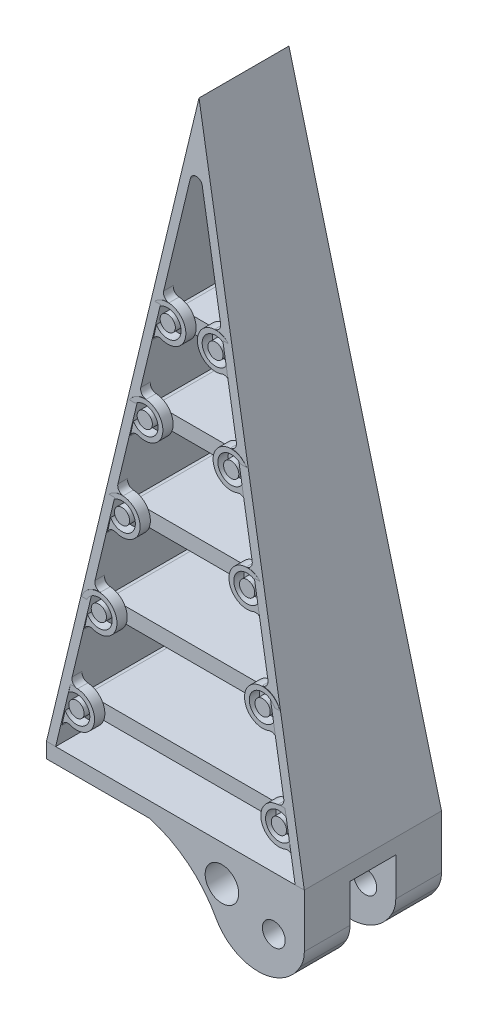
from build123d import *
from build123d.topology import SkipClean

# Parameters (mm, degrees)
AUFSATZ_LINEAR_AUSTRAGEN4_DEPTH      = 18
SCHNITT_LINEAR_AUSTRAGEN1_DEPTH      = 89.73537072
AUFSATZ_LINEAR_AUSTRAGEN5_DEPTH      = 5.37
AUFSATZ_LINEAR_AUSTRAGEN5_DEPTH_BACK = 5.37
AUFSATZ_LINEAR_AUSTRAGEN6_DEPTH      = 5.85
AUFSATZ_LINEAR_AUSTRAGEN6_DEPTH_BACK = 5.85
AUFSATZ_LINEAR_AUSTRAGEN7_DEPTH      = 6.3
AUFSATZ_LINEAR_AUSTRAGEN7_DEPTH_BACK = 6.3
AUFSATZ_LINEAR_AUSTRAGEN8_DEPTH      = 6.8
AUFSATZ_LINEAR_AUSTRAGEN8_DEPTH_BACK = 6.8
AUFSATZ_LINEAR_AUSTRAGEN9_DEPTH      = 7.2
AUFSATZ_LINEAR_AUSTRAGEN9_DEPTH_BACK = 7.2
SKIZZE13_R                           = 1
AUFSATZ_LINEAR_AUSTRAGEN12_DEPTH     = 1.5
SKIZZE15_R                           = 1
AUFSATZ_LINEAR_AUSTRAGEN14_DEPTH     = 1.5
SKIZZE14_R                           = 1
AUFSATZ_LINEAR_AUSTRAGEN13_DEPTH     = 1.5
SKIZZE16_R                           = 1
AUFSATZ_LINEAR_AUSTRAGEN15_DEPTH     = 1.5
SKIZZE17_R                           = 1
AUFSATZ_LINEAR_AUSTRAGEN16_DEPTH     = 1.5
SKIZZE18_R                           = 1
AUFSATZ_LINEAR_AUSTRAGEN17_DEPTH     = 1.5
SKIZZE19_R                           = 1
AUFSATZ_LINEAR_AUSTRAGEN18_DEPTH     = 1.5
SKIZZE20_R                           = 1
AUFSATZ_LINEAR_AUSTRAGEN19_DEPTH     = 1.5
SKIZZE21_R                           = 1
AUFSATZ_LINEAR_AUSTRAGEN20_DEPTH     = 1.5
SKIZZE22_R                           = 1
AUFSATZ_LINEAR_AUSTRAGEN21_DEPTH     = 1.5
SKIZZE24_R                           = 2.375
SKIZZE24_R_2                         = 1.75
AUFSATZ_LINEAR_AUSTRAGEN22_DEPTH     = 1.35
SKIZZE25_R                           = 2.375
SKIZZE25_R_2                         = 1.75
AUFSATZ_LINEAR_AUSTRAGEN23_DEPTH     = 1.35
SKIZZE26_R                           = 2.375
SKIZZE26_R_2                         = 1.75
AUFSATZ_LINEAR_AUSTRAGEN24_DEPTH     = 1.35
SKIZZE27_R                           = 2.375
SKIZZE27_R_2                         = 1.75
AUFSATZ_LINEAR_AUSTRAGEN25_DEPTH     = 1.35
SKIZZE28_R                           = 2.375
SKIZZE28_R_2                         = 1.75
AUFSATZ_LINEAR_AUSTRAGEN26_DEPTH     = 1.35
AUFSATZ_LINEAR_START                 = -1.35
SKIZZE29_R                           = 2.375
SKIZZE29_R_2                         = 1.75
AUFSATZ_LINEAR_AUSTRAGEN27_DEPTH     = 1.35
SKIZZE30_R                           = 2.375
SKIZZE30_R_2                         = 1.75
AUFSATZ_LINEAR_AUSTRAGEN28_DEPTH     = 1.35
SKIZZE31_R                           = 2.375
SKIZZE31_R_2                         = 1.75
AUFSATZ_LINEAR_AUSTRAGEN29_DEPTH     = 1.35
SKIZZE32_R                           = 2.375
SKIZZE32_R_2                         = 1.75
AUFSATZ_LINEAR_AUSTRAGEN30_DEPTH     = 1.35
SKIZZE33_R                           = 2.375
SKIZZE33_R_2                         = 1.75
AUFSATZ_LINEAR_AUSTRAGEN31_DEPTH     = 1.35
VERRUNDUNG1_R                        = 0.8
VERRUNDUNG2_R                        = 0.8
AUFSATZ_LINEAR_AUSTRAGEN32_DEPTH     = 2
SKIZZE38_R                           = 4
SKIZZE38_R_2                         = 1.5
AUFSATZ_LINEAR_AUSTRAGEN34_DEPTH     = 18
SCHNITT_LINEAR_START                 = -6
SKIZZE39_R                           = 4
SCHNITT_LINEAR_AUSTRAGEN2_DEPTH      = 6
SKIZZE40_W                           = 6
SKIZZE40_H                           = 11.711498973
SCHNITT_LINEAR_AUSTRAGEN3_DEPTH      = 43.6
SKIZZE41_R                           = 2.2
SCHNITT_LINEAR_AUSTRAGEN4_DEPTH      = 96.518560321
AUFSATZ_LINEAR_AUSTRAGEN35_DEPTH     = 25


with BuildPart() as part:
    # Skizze1 → Aufsatz-Linear austragen4 (new body)
    with BuildSketch(Plane.XY):
        Polygon((0, 0), (16.911148858, -80), (15.711148858, -80), (0, -5.676728459), (-15.711148858, -80), (-16.911148858, -80), align=None)
    extrude(amount=AUFSATZ_LINEAR_AUSTRAGEN4_DEPTH)

    # Skizze11 → Schnitt-Linear austragen1 (cut, through all)
    with BuildSketch(Plane(origin=(17, 0, 0), x_dir=(0, 0, -1), z_dir=(1, 0, 0))):
        Polygon((-18, -80), (-14.9, 0), (-18, 0), align=None)
        Polygon((0, -80), (-3.1, 0), (0, 0), align=None)
    extrude(amount=-SCHNITT_LINEAR_AUSTRAGEN1_DEPTH, mode=Mode.SUBTRACT)

    # Skizze24 → Aufsatz-Linear austragen22 (add)
    # profile 1 of 2: a face of its own
    with BuildSketch(Plane.XY.offset(15.87)):
        with Locations((-3.132547008, -26.676728459)):
            Circle(SKIZZE24_R)
        with Locations((-3.132547008, -26.676728459)):
            Circle(SKIZZE24_R_2, mode=Mode.SUBTRACT)
    # profile 2 of 2: a face of its own
    with BuildSketch(Plane.XY.offset(15.87)):
        with Locations((3.132547008, -26.676728459)):
            Circle(SKIZZE24_R)
        with Locations((3.132547008, -26.676728459)):
            Circle(SKIZZE24_R_2, mode=Mode.SUBTRACT)
    extrude(amount=-AUFSATZ_LINEAR_AUSTRAGEN22_DEPTH)

    # Skizze25 → Aufsatz-Linear austragen23 (add)
    # profile 1 of 2: a face of its own
    with BuildSketch(Plane.XY.offset(16.35)):
        with Locations((-5.669219336, -38.676728459)):
            Circle(SKIZZE25_R)
        with Locations((-5.669219336, -38.676728459)):
            Circle(SKIZZE25_R_2, mode=Mode.SUBTRACT)
    # profile 2 of 2: a face of its own
    with BuildSketch(Plane.XY.offset(16.35)):
        with Locations((5.669219336, -38.676728459)):
            Circle(SKIZZE25_R)
        with Locations((5.669219336, -38.676728459)):
            Circle(SKIZZE25_R_2, mode=Mode.SUBTRACT)
    extrude(amount=-AUFSATZ_LINEAR_AUSTRAGEN23_DEPTH)

    # Skizze26 → Aufsatz-Linear austragen24 (add)
    # profile 1 of 2: a face of its own
    with BuildSketch(Plane.XY.offset(16.8)):
        with Locations((-8.205891665, -50.676728459)):
            Circle(SKIZZE26_R)
        with Locations((-8.205891665, -50.676728459)):
            Circle(SKIZZE26_R_2, mode=Mode.SUBTRACT)
    # profile 2 of 2: a face of its own
    with BuildSketch(Plane.XY.offset(16.8)):
        with Locations((8.205891665, -50.676728459)):
            Circle(SKIZZE26_R)
        with Locations((8.205891665, -50.676728459)):
            Circle(SKIZZE26_R_2, mode=Mode.SUBTRACT)
    extrude(amount=-AUFSATZ_LINEAR_AUSTRAGEN24_DEPTH)

    # Skizze27 → Aufsatz-Linear austragen25 (add)
    # profile 1 of 2: a face of its own
    with BuildSketch(Plane.XY.offset(17.3)):
        with Locations((-10.742563994, -62.676728459)):
            Circle(SKIZZE27_R)
        with Locations((-10.742563994, -62.676728459)):
            Circle(SKIZZE27_R_2, mode=Mode.SUBTRACT)
    # profile 2 of 2: a face of its own
    with BuildSketch(Plane.XY.offset(17.3)):
        with Locations((10.742563994, -62.676728459)):
            Circle(SKIZZE27_R)
        with Locations((10.742563994, -62.676728459)):
            Circle(SKIZZE27_R_2, mode=Mode.SUBTRACT)
    extrude(amount=-AUFSATZ_LINEAR_AUSTRAGEN25_DEPTH)

    # Skizze28 → Aufsatz-Linear austragen26 (add)
    # profile 1 of 2: a face of its own
    with BuildSketch(Plane.XY.offset(17.7)):
        with Locations((-13.279236322, -74.676728459)):
            Circle(SKIZZE28_R)
        with Locations((-13.279236322, -74.676728459)):
            Circle(SKIZZE28_R_2, mode=Mode.SUBTRACT)
    # profile 2 of 2: a face of its own
    with BuildSketch(Plane.XY.offset(17.7)):
        with Locations((13.279236322, -74.676728459)):
            Circle(SKIZZE28_R)
        with Locations((13.279236322, -74.676728459)):
            Circle(SKIZZE28_R_2, mode=Mode.SUBTRACT)
    extrude(amount=-AUFSATZ_LINEAR_AUSTRAGEN26_DEPTH)

    # Skizze29 → Aufsatz-Linear austragen27 (add)
    # profile 1 of 2: a face of its own
    with BuildSketch(Plane(origin=(0, 0, 2.13), x_dir=(-1, 0, 0), z_dir=(0, 0, -1)).offset(AUFSATZ_LINEAR_START)):
        with Locations((-3.132547008, -26.676728459)):
            Circle(SKIZZE29_R)
        with Locations((-3.132547008, -26.676728459)):
            Circle(SKIZZE29_R_2, mode=Mode.SUBTRACT)
    # profile 2 of 2: a face of its own
    with BuildSketch(Plane(origin=(0, 0, 2.13), x_dir=(-1, 0, 0), z_dir=(0, 0, -1)).offset(AUFSATZ_LINEAR_START)):
        with Locations((3.132547008, -26.676728459)):
            Circle(SKIZZE29_R)
        with Locations((3.132547008, -26.676728459)):
            Circle(SKIZZE29_R_2, mode=Mode.SUBTRACT)
    extrude(amount=AUFSATZ_LINEAR_AUSTRAGEN27_DEPTH)

    # Skizze30 → Aufsatz-Linear austragen28 (add)
    # profile 1 of 2: a face of its own
    with BuildSketch(Plane(origin=(0, 0, 1.65), x_dir=(-1, 0, 0), z_dir=(0, 0, -1)).offset(AUFSATZ_LINEAR_START)):
        with Locations((-5.669219336, -38.676728459)):
            Circle(SKIZZE30_R)
        with Locations((-5.669219336, -38.676728459)):
            Circle(SKIZZE30_R_2, mode=Mode.SUBTRACT)
    # profile 2 of 2: a face of its own
    with BuildSketch(Plane(origin=(0, 0, 1.65), x_dir=(-1, 0, 0), z_dir=(0, 0, -1)).offset(AUFSATZ_LINEAR_START)):
        with Locations((5.669219336, -38.676728459)):
            Circle(SKIZZE30_R)
        with Locations((5.669219336, -38.676728459)):
            Circle(SKIZZE30_R_2, mode=Mode.SUBTRACT)
    extrude(amount=AUFSATZ_LINEAR_AUSTRAGEN28_DEPTH)

    # Skizze31 → Aufsatz-Linear austragen29 (add)
    # profile 1 of 2: a face of its own
    with BuildSketch(Plane(origin=(0, 0, 1.2), x_dir=(-1, 0, 0), z_dir=(0, 0, -1)).offset(AUFSATZ_LINEAR_START)):
        with Locations((-8.205891665, -50.676728459)):
            Circle(SKIZZE31_R)
        with Locations((-8.205891665, -50.676728459)):
            Circle(SKIZZE31_R_2, mode=Mode.SUBTRACT)
    # profile 2 of 2: a face of its own
    with BuildSketch(Plane(origin=(0, 0, 1.2), x_dir=(-1, 0, 0), z_dir=(0, 0, -1)).offset(AUFSATZ_LINEAR_START)):
        with Locations((8.205891665, -50.676728459)):
            Circle(SKIZZE31_R)
        with Locations((8.205891665, -50.676728459)):
            Circle(SKIZZE31_R_2, mode=Mode.SUBTRACT)
    extrude(amount=AUFSATZ_LINEAR_AUSTRAGEN29_DEPTH)

    # Skizze32 → Aufsatz-Linear austragen30 (add)
    # profile 1 of 2: a face of its own
    with BuildSketch(Plane(origin=(0, 0, 0.7), x_dir=(-1, 0, 0), z_dir=(0, 0, -1)).offset(AUFSATZ_LINEAR_START)):
        with Locations((-10.742563994, -62.676728459)):
            Circle(SKIZZE32_R)
        with Locations((-10.742563994, -62.676728459)):
            Circle(SKIZZE32_R_2, mode=Mode.SUBTRACT)
    # profile 2 of 2: a face of its own
    with BuildSketch(Plane(origin=(0, 0, 0.7), x_dir=(-1, 0, 0), z_dir=(0, 0, -1)).offset(AUFSATZ_LINEAR_START)):
        with Locations((10.742563994, -62.676728459)):
            Circle(SKIZZE32_R)
        with Locations((10.742563994, -62.676728459)):
            Circle(SKIZZE32_R_2, mode=Mode.SUBTRACT)
    extrude(amount=AUFSATZ_LINEAR_AUSTRAGEN30_DEPTH)

    # Skizze33 → Aufsatz-Linear austragen31 (add)
    # profile 1 of 2: a face of its own
    with BuildSketch(Plane(origin=(0, 0, 0.3), x_dir=(-1, 0, 0), z_dir=(0, 0, -1)).offset(AUFSATZ_LINEAR_START)):
        with Locations((-13.279236322, -74.676728459)):
            Circle(SKIZZE33_R)
        with Locations((-13.279236322, -74.676728459)):
            Circle(SKIZZE33_R_2, mode=Mode.SUBTRACT)
    # profile 2 of 2: a face of its own
    with BuildSketch(Plane(origin=(0, 0, 0.3), x_dir=(-1, 0, 0), z_dir=(0, 0, -1)).offset(AUFSATZ_LINEAR_START)):
        with Locations((13.279236322, -74.676728459)):
            Circle(SKIZZE33_R)
        with Locations((13.279236322, -74.676728459)):
            Circle(SKIZZE33_R_2, mode=Mode.SUBTRACT)
    extrude(amount=AUFSATZ_LINEAR_AUSTRAGEN31_DEPTH)

    # Verrundung1
    verrundung1_edges = [part.edges().sort_by_distance(p)[0] for p in [
        (0, -5.676728459, 9),
    ]]
    fillet(verrundung1_edges, radius=VERRUNDUNG1_R)

    # Verrundung2
    # the kernel refuses this fillet: 0.8 mm, written as the material it adds along each edge
    with BuildSketch(Plane(origin=(7.333926251, -40.370651683, 15), x_dir=(0.20681895998091462, -0.9783792300495819, 0), z_dir=(0, 0, 1)), Plane(origin=(9.87059858, -52.370651683, 15.45), x_dir=(0.20681895998091263, -0.9783792300495825, 0), z_dir=(0, 0, 1)), Plane(origin=(12.407270908, -64.370651683, 15.95), x_dir=(0.20681895998091412, -0.9783792300495822, 0), z_dir=(0, 0, 1)), Plane(origin=(14.943943237, -76.370651683, 16.35), x_dir=(0.20681895998090907, -0.9783792300495833, 0), z_dir=(0, 0, 1)), Plane(origin=(4.797253922, -28.370651683, 2.13), x_dir=(0.20681895998091462, -0.9783792300495819, 0), z_dir=(0, 0, 1)), Plane(origin=(7.333926251, -40.370651683, 1.65), x_dir=(0.20681895998091462, -0.9783792300495819, 0), z_dir=(0, 0, 1)), Plane(origin=(9.87059858, -52.370651683, 1.2), x_dir=(0.20681895998091412, -0.9783792300495822, 0), z_dir=(0, 0, 1)), Plane(origin=(12.407270908, -64.370651683, 0.7), x_dir=(0.20681895998091412, -0.9783792300495822, 0), z_dir=(0, 0, 1)), Plane(origin=(14.943943237, -76.370651683, 0.3), x_dir=(0.20681895998091113, -0.9783792300495827, 0), z_dir=(0, 0, 1)), Plane(origin=(4.797253922, -28.370651683, 14.52), x_dir=(0.20681895998091462, -0.9783792300495819, 0), z_dir=(0, 0, 1))) as verrundung2_piece_1:
        with BuildLine():
            CenterArc((1.137162009, -0.8), VERRUNDUNG2_R, 90, 98.665792169)
            ThreePointArc((0.346294794, -0.920536499), (0.221320117, -0.44214625), (0, 0))
            Line((0, 0), (1.137162009, 0))
        make_face()
    extrude(amount=1.35)
    with BuildSketch(Plane(origin=(6.505991795, -36.45401911, 15), x_dir=(-0.20681895998091487, 0.9783792300495819, 0), z_dir=(0, 0, 1))) as verrundung2_piece_2_section:
        with BuildLine():
            CenterArc((1.137162009, 0.8), VERRUNDUNG2_R, 171.334207831, 98.665792169)
            ThreePointArc((0.346294794, 0.920536499), (0.221320117, 0.44214625), (0, 0))
            Line((0, 0), (1.137162009, 0))
        make_face()
    verrundung2_piece_2 = extrude(amount=4.155498263, mode=Mode.PRIVATE)
    verrundung2_piece_2 = split(verrundung2_piece_2, bisect_by=Plane(origin=(6.217215771, -36.095589606, 16.298704097), z_dir=(0, -0.03872093994908253, -0.9992500632021294)), keep=Keep.TOP, mode=Mode.PRIVATE)
    add(verrundung2_piece_2)
    with BuildSketch(Plane(origin=(-9.87059858, -52.370651683, 15.45), x_dir=(-0.20681895998091412, -0.9783792300495822, 0), z_dir=(0, 0, 1)), Plane(origin=(-12.407270908, -64.370651683, 15.95), x_dir=(-0.2068189599809156, -0.9783792300495817, 0), z_dir=(0, 0, 1)), Plane(origin=(-14.943943237, -76.370651683, 16.35), x_dir=(-0.2068189599809131, -0.9783792300495824, 0), z_dir=(0, 0, 1)), Plane(origin=(-4.797253922, -28.370651683, 2.13), x_dir=(-0.20681895998091113, -0.9783792300495827, 0), z_dir=(0, 0, 1)), Plane(origin=(-7.333926251, -40.370651683, 1.65), x_dir=(-0.2068189599809139, -0.9783792300495822, 0), z_dir=(0, 0, 1)), Plane(origin=(-9.87059858, -52.370651683, 1.2), x_dir=(-0.20681895998091412, -0.9783792300495822, 0), z_dir=(0, 0, 1)), Plane(origin=(-12.407270908, -64.370651683, 0.7), x_dir=(-0.20681895998091412, -0.9783792300495822, 0), z_dir=(0, 0, 1)), Plane(origin=(-14.943943237, -76.370651683, 0.3), x_dir=(-0.2068189599809131, -0.9783792300495824, 0), z_dir=(0, 0, 1)), Plane(origin=(-4.797253922, -28.370651683, 14.52), x_dir=(-0.20681895998091177, -0.9783792300495826, 0), z_dir=(0, 0, 1)), Plane(origin=(-7.333926251, -40.370651683, 15), x_dir=(-0.20681895998091412, -0.9783792300495822, 0), z_dir=(0, 0, 1))) as verrundung2_piece_3:
        with BuildLine():
            CenterArc((1.137162009, 0.8), VERRUNDUNG2_R, 171.334207831, 98.665792169)
            ThreePointArc((0.346294794, 0.920536499), (0.221320117, 0.44214625), (0, 0))
            Line((0, 0), (1.137162009, 0))
        make_face()
    extrude(amount=1.35)
    with BuildSketch(Plane(origin=(-9.042664124, -48.45401911, 15.45), x_dir=(0.20681895998091288, 0.9783792300495825, 0), z_dir=(0, 0, 1))) as verrundung2_piece_4_section:
        with BuildLine():
            CenterArc((1.137162009, -0.8), VERRUNDUNG2_R, 90, 98.665792169)
            ThreePointArc((0.346294794, -0.920536499), (0.221320117, -0.44214625), (0, 0))
            Line((0, 0), (1.137162009, 0))
        make_face()
    verrundung2_piece_4 = extrude(amount=4.170498263, mode=Mode.PRIVATE)
    verrundung2_piece_4 = split(verrundung2_piece_4, bisect_by=Plane(origin=(-8.753891259, -48.095283689, 16.763692243), z_dir=(0, -0.03872093994908253, -0.9992500632021294)), keep=Keep.TOP, mode=Mode.PRIVATE)
    add(verrundung2_piece_4)
    with BuildSketch(Plane(origin=(9.042664124, -48.45401911, 15.45), x_dir=(-0.2068189599809156, 0.9783792300495817, 0), z_dir=(0, 0, 1))) as verrundung2_piece_5_section:
        with BuildLine():
            CenterArc((1.137162009, 0.8), VERRUNDUNG2_R, 171.334207831, 98.665792169)
            ThreePointArc((0.346294794, 0.920536499), (0.221320117, 0.44214625), (0, 0))
            Line((0, 0), (1.137162009, 0))
        make_face()
    verrundung2_piece_5 = extrude(amount=4.170498263, mode=Mode.PRIVATE)
    verrundung2_piece_5 = split(verrundung2_piece_5, bisect_by=Plane(origin=(8.753891259, -48.095283689, 16.763692243), z_dir=(0, -0.03872093994908253, -0.9992500632021294)), keep=Keep.TOP, mode=Mode.PRIVATE)
    add(verrundung2_piece_5)
    with BuildSketch(Plane(origin=(-11.579336453, -60.45401911, 15.95), x_dir=(0.2068189599809101, 0.9783792300495829, 0), z_dir=(0, 0, 1))) as verrundung2_piece_6_section:
        with BuildLine():
            CenterArc((1.137162009, -0.8), VERRUNDUNG2_R, 90, 98.665792169)
            ThreePointArc((0.346294794, -0.920536499), (0.221320117, -0.44214625), (0, 0))
            Line((0, 0), (1.137162009, 0))
        make_face()
    verrundung2_piece_6 = extrude(amount=4.135498263, mode=Mode.PRIVATE)
    verrundung2_piece_6 = split(verrundung2_piece_6, bisect_by=Plane(origin=(-11.290556099, -60.095998069, 17.228719925), z_dir=(0, -0.03872093994908253, -0.9992500632021294)), keep=Keep.TOP, mode=Mode.PRIVATE)
    add(verrundung2_piece_6)
    with BuildSketch(Plane(origin=(11.579336453, -60.45401911, 15.95), x_dir=(-0.20681895998091435, 0.978379230049582, 0), z_dir=(0, 0, 1))) as verrundung2_piece_7_section:
        with BuildLine():
            CenterArc((1.137162009, 0.8), VERRUNDUNG2_R, 171.334207831, 98.665792169)
            ThreePointArc((0.346294794, 0.920536499), (0.221320117, 0.44214625), (0, 0))
            Line((0, 0), (1.137162009, 0))
        make_face()
    verrundung2_piece_7 = extrude(amount=4.135498263, mode=Mode.PRIVATE)
    verrundung2_piece_7 = split(verrundung2_piece_7, bisect_by=Plane(origin=(11.290556099, -60.095998069, 17.228719925), z_dir=(0, -0.03872093994908253, -0.9992500632021294)), keep=Keep.TOP, mode=Mode.PRIVATE)
    add(verrundung2_piece_7)
    with BuildSketch(Plane(origin=(-14.116008781, -72.45401911, 16.35), x_dir=(0.20681895998091412, 0.9783792300495822, 0), z_dir=(0, 0, 1))) as verrundung2_piece_8_section:
        with BuildLine():
            CenterArc((1.137162009, -0.8), VERRUNDUNG2_R, 90, 98.665792169)
            ThreePointArc((0.346294794, -0.920536499), (0.221320117, -0.44214625), (0, 0))
            Line((0, 0), (1.137162009, 0))
        make_face()
    verrundung2_piece_8 = extrude(amount=1.35, mode=Mode.PRIVATE)
    verrundung2_piece_8 = split(verrundung2_piece_8, bisect_by=Plane(origin=(-13.827218085, -72.094512866, 17.693662374), z_dir=(0, -0.03872093994908253, -0.9992500632021294)), keep=Keep.TOP, mode=Mode.PRIVATE)
    add(verrundung2_piece_8)
    with BuildSketch(Plane(origin=(14.116008781, -72.45401911, 16.35), x_dir=(-0.20681895998091662, 0.9783792300495815, 0), z_dir=(0, 0, 1))) as verrundung2_piece_9_section:
        with BuildLine():
            CenterArc((1.137162009, 0.8), VERRUNDUNG2_R, 171.334207831, 98.665792169)
            ThreePointArc((0.346294794, 0.920536499), (0.221320117, 0.44214625), (0, 0))
            Line((0, 0), (1.137162009, 0))
        make_face()
    verrundung2_piece_9 = extrude(amount=1.35, mode=Mode.PRIVATE)
    verrundung2_piece_9 = split(verrundung2_piece_9, bisect_by=Plane(origin=(13.827218085, -72.094512866, 17.693662374), z_dir=(0, -0.03872093994908253, -0.9992500632021294)), keep=Keep.TOP, mode=Mode.PRIVATE)
    add(verrundung2_piece_9)
    with BuildSketch(Plane(origin=(3.969319467, -24.45401911, -0.690498263), x_dir=(-0.20681895998091412, 0.9783792300495822, 0), z_dir=(0, 0, 1))) as verrundung2_piece_10_section:
        with BuildLine():
            CenterArc((1.137162009, 0.8), VERRUNDUNG2_R, 171.334207831, 98.665792169)
            ThreePointArc((0.346294794, 0.920536499), (0.221320117, 0.44214625), (0, 0))
            Line((0, 0), (1.137162009, 0))
        make_face()
    verrundung2_piece_10 = extrude(amount=4.170498263, mode=Mode.PRIVATE)
    verrundung2_piece_10 = split(verrundung2_piece_10, bisect_by=Plane(origin=(3.680546602, -24.095283689, 2.166307757), z_dir=(0, -0.03872093994908251, 0.9992500632021294)), keep=Keep.TOP, mode=Mode.PRIVATE)
    add(verrundung2_piece_10)
    with BuildSketch(Plane(origin=(-3.969319467, -24.45401911, -0.690498263), x_dir=(0.20681895998091285, 0.9783792300495823, 0), z_dir=(0, 0, 1))) as verrundung2_piece_11_section:
        with BuildLine():
            CenterArc((1.137162009, -0.8), VERRUNDUNG2_R, 90, 98.665792169)
            ThreePointArc((0.346294794, -0.920536499), (0.221320117, -0.44214625), (0, 0))
            Line((0, 0), (1.137162009, 0))
        make_face()
    verrundung2_piece_11 = extrude(amount=4.170498263, mode=Mode.PRIVATE)
    verrundung2_piece_11 = split(verrundung2_piece_11, bisect_by=Plane(origin=(-3.680546602, -24.095283689, 2.166307757), z_dir=(0, -0.03872093994908251, 0.9992500632021294)), keep=Keep.TOP, mode=Mode.PRIVATE)
    add(verrundung2_piece_11)
    with BuildSketch(Plane(origin=(6.505991795, -36.45401911, -1.155498263), x_dir=(-0.20681895998091537, 0.9783792300495818, 0), z_dir=(0, 0, 1))) as verrundung2_piece_12_section:
        with BuildLine():
            CenterArc((1.137162009, 0.8), VERRUNDUNG2_R, 171.334207831, 98.665792169)
            ThreePointArc((0.346294794, 0.920536499), (0.221320117, 0.44214625), (0, 0))
            Line((0, 0), (1.137162009, 0))
        make_face()
    verrundung2_piece_12 = extrude(amount=4.155498263, mode=Mode.PRIVATE)
    verrundung2_piece_12 = split(verrundung2_piece_12, bisect_by=Plane(origin=(6.217215771, -36.095589606, 1.701295903), z_dir=(0, -0.03872093994908251, 0.9992500632021294)), keep=Keep.TOP, mode=Mode.PRIVATE)
    add(verrundung2_piece_12)
    with BuildSketch(Plane(origin=(-6.505991795, -36.45401911, -1.155498263), x_dir=(0.20681895998091288, 0.9783792300495825, 0), z_dir=(0, 0, 1))) as verrundung2_piece_13_section:
        with BuildLine():
            CenterArc((1.137162009, -0.8), VERRUNDUNG2_R, 90, 98.665792169)
            ThreePointArc((0.346294794, -0.920536499), (0.221320117, -0.44214625), (0, 0))
            Line((0, 0), (1.137162009, 0))
        make_face()
    verrundung2_piece_13 = extrude(amount=4.155498263, mode=Mode.PRIVATE)
    verrundung2_piece_13 = split(verrundung2_piece_13, bisect_by=Plane(origin=(-6.217215771, -36.095589606, 1.701295903), z_dir=(0, -0.03872093994908251, 0.9992500632021294)), keep=Keep.TOP, mode=Mode.PRIVATE)
    add(verrundung2_piece_13)
    with BuildSketch(Plane(origin=(9.042664124, -48.45401911, -1.620498263), x_dir=(-0.20681895998091412, 0.9783792300495822, 0), z_dir=(0, 0, 1))) as verrundung2_piece_14_section:
        with BuildLine():
            CenterArc((1.137162009, 0.8), VERRUNDUNG2_R, 171.334207831, 98.665792169)
            ThreePointArc((0.346294794, 0.920536499), (0.221320117, 0.44214625), (0, 0))
            Line((0, 0), (1.137162009, 0))
        make_face()
    verrundung2_piece_14 = extrude(amount=4.170498263, mode=Mode.PRIVATE)
    verrundung2_piece_14 = split(verrundung2_piece_14, bisect_by=Plane(origin=(8.753891259, -48.095283689, 1.236307757), z_dir=(0, -0.03872093994908251, 0.9992500632021294)), keep=Keep.TOP, mode=Mode.PRIVATE)
    add(verrundung2_piece_14)
    with BuildSketch(Plane(origin=(-9.042664124, -48.45401911, -1.620498263), x_dir=(0.20681895998091263, 0.9783792300495825, 0), z_dir=(0, 0, 1))) as verrundung2_piece_15_section:
        with BuildLine():
            CenterArc((1.137162009, -0.8), VERRUNDUNG2_R, 90, 98.665792169)
            ThreePointArc((0.346294794, -0.920536499), (0.221320117, -0.44214625), (0, 0))
            Line((0, 0), (1.137162009, 0))
        make_face()
    verrundung2_piece_15 = extrude(amount=4.170498263, mode=Mode.PRIVATE)
    verrundung2_piece_15 = split(verrundung2_piece_15, bisect_by=Plane(origin=(-8.753891259, -48.095283689, 1.236307757), z_dir=(0, -0.03872093994908251, 0.9992500632021294)), keep=Keep.TOP, mode=Mode.PRIVATE)
    add(verrundung2_piece_15)
    with BuildSketch(Plane(origin=(11.579336453, -60.45401911, -2.085498263), x_dir=(-0.20681895998091412, 0.9783792300495822, 0), z_dir=(0, 0, 1))) as verrundung2_piece_16_section:
        with BuildLine():
            CenterArc((1.137162009, 0.8), VERRUNDUNG2_R, 171.334207831, 98.665792169)
            ThreePointArc((0.346294794, 0.920536499), (0.221320117, 0.44214625), (0, 0))
            Line((0, 0), (1.137162009, 0))
        make_face()
    verrundung2_piece_16 = extrude(amount=4.135498263, mode=Mode.PRIVATE)
    verrundung2_piece_16 = split(verrundung2_piece_16, bisect_by=Plane(origin=(11.290556099, -60.095998069, 0.771280075), z_dir=(0, -0.03872093994908251, 0.9992500632021294)), keep=Keep.TOP, mode=Mode.PRIVATE)
    add(verrundung2_piece_16)
    with BuildSketch(Plane(origin=(-11.579336453, -60.45401911, -2.085498263), x_dir=(0.2068189599809131, 0.9783792300495824, 0), z_dir=(0, 0, 1))) as verrundung2_piece_17_section:
        with BuildLine():
            CenterArc((1.137162009, -0.8), VERRUNDUNG2_R, 90, 98.665792169)
            ThreePointArc((0.346294794, -0.920536499), (0.221320117, -0.44214625), (0, 0))
            Line((0, 0), (1.137162009, 0))
        make_face()
    verrundung2_piece_17 = extrude(amount=4.135498263, mode=Mode.PRIVATE)
    verrundung2_piece_17 = split(verrundung2_piece_17, bisect_by=Plane(origin=(-11.290556099, -60.095998069, 0.771280075), z_dir=(0, -0.03872093994908251, 0.9992500632021294)), keep=Keep.TOP, mode=Mode.PRIVATE)
    add(verrundung2_piece_17)
    with BuildSketch(Plane(origin=(14.116008781, -72.45401911, 0.3), x_dir=(-0.2068189599809156, 0.9783792300495817, 0), z_dir=(0, 0, 1))) as verrundung2_piece_18_section:
        with BuildLine():
            CenterArc((1.137162009, 0.8), VERRUNDUNG2_R, 171.334207831, 98.665792169)
            ThreePointArc((0.346294794, 0.920536499), (0.221320117, 0.44214625), (0, 0))
            Line((0, 0), (1.137162009, 0))
        make_face()
    verrundung2_piece_18 = extrude(amount=1.35, mode=Mode.PRIVATE)
    verrundung2_piece_18 = split(verrundung2_piece_18, bisect_by=Plane(origin=(13.827218085, -72.094512866, 0.306337626), z_dir=(0, -0.03872093994908251, 0.9992500632021294)), keep=Keep.TOP, mode=Mode.PRIVATE)
    add(verrundung2_piece_18)
    with BuildSketch(Plane(origin=(-14.116008781, -72.45401911, 0.3), x_dir=(0.20681895998091412, 0.9783792300495822, 0), z_dir=(0, 0, 1))) as verrundung2_piece_19_section:
        with BuildLine():
            CenterArc((1.137162009, -0.8), VERRUNDUNG2_R, 90, 98.665792169)
            ThreePointArc((0.346294794, -0.920536499), (0.221320117, -0.44214625), (0, 0))
            Line((0, 0), (1.137162009, 0))
        make_face()
    verrundung2_piece_19 = extrude(amount=1.35, mode=Mode.PRIVATE)
    verrundung2_piece_19 = split(verrundung2_piece_19, bisect_by=Plane(origin=(-13.827218085, -72.094512866, 0.306337626), z_dir=(0, -0.03872093994908251, 0.9992500632021294)), keep=Keep.TOP, mode=Mode.PRIVATE)
    add(verrundung2_piece_19)
    with BuildSketch(Plane(origin=(-3.969319467, -24.45401911, 14.52), x_dir=(0.20681895998091399, 0.978379230049582, 0), z_dir=(0, 0, 1))) as verrundung2_piece_20_section:
        with BuildLine():
            CenterArc((1.137162009, -0.8), VERRUNDUNG2_R, 90, 98.665792169)
            ThreePointArc((0.346294794, -0.920536499), (0.221320117, -0.44214625), (0, 0))
            Line((0, 0), (1.137162009, 0))
        make_face()
    verrundung2_piece_20 = extrude(amount=4.170498263, mode=Mode.PRIVATE)
    verrundung2_piece_20 = split(verrundung2_piece_20, bisect_by=Plane(origin=(-3.680546602, -24.095283689, 15.833692243), z_dir=(0, -0.03872093994908253, -0.9992500632021294)), keep=Keep.TOP, mode=Mode.PRIVATE)
    add(verrundung2_piece_20)
    with BuildSketch(Plane(origin=(3.969319467, -24.45401911, 14.52), x_dir=(-0.20681895998091487, 0.9783792300495819, 0), z_dir=(0, 0, 1))) as verrundung2_piece_21_section:
        with BuildLine():
            CenterArc((1.137162009, 0.8), VERRUNDUNG2_R, 171.334207831, 98.665792169)
            ThreePointArc((0.346294794, 0.920536499), (0.221320117, 0.44214625), (0, 0))
            Line((0, 0), (1.137162009, 0))
        make_face()
    verrundung2_piece_21 = extrude(amount=4.170498263, mode=Mode.PRIVATE)
    verrundung2_piece_21 = split(verrundung2_piece_21, bisect_by=Plane(origin=(3.680546602, -24.095283689, 15.833692243), z_dir=(0, -0.03872093994908253, -0.9992500632021294)), keep=Keep.TOP, mode=Mode.PRIVATE)
    add(verrundung2_piece_21)
    with BuildSketch(Plane(origin=(-6.505991795, -36.45401911, 15), x_dir=(0.20681895998091263, 0.9783792300495825, 0), z_dir=(0, 0, 1))) as verrundung2_piece_22_section:
        with BuildLine():
            CenterArc((1.137162009, -0.8), VERRUNDUNG2_R, 90, 98.665792169)
            ThreePointArc((0.346294794, -0.920536499), (0.221320117, -0.44214625), (0, 0))
            Line((0, 0), (1.137162009, 0))
        make_face()
    verrundung2_piece_22 = extrude(amount=4.155498263, mode=Mode.PRIVATE)
    verrundung2_piece_22 = split(verrundung2_piece_22, bisect_by=Plane(origin=(-6.217215771, -36.095589606, 16.298704097), z_dir=(0, -0.03872093994908253, -0.9992500632021294)), keep=Keep.TOP, mode=Mode.PRIVATE)
    add(verrundung2_piece_22)

    # Skizze37 → Aufsatz-Linear austragen32 (add)
    with BuildSketch(Plane.XZ.offset(80)):
        Polygon((-16.911148858, 0), (-15.711148858, 0), (16.911148858, 0), (16.911148858, 18), (-16.911148858, 18), align=None)
    extrude(amount=AUFSATZ_LINEAR_AUSTRAGEN32_DEPTH)

    # Skizze38 → Aufsatz-Linear austragen34 (add)
    # profile 1 of 2: a face of its own
    with BuildSketch(Plane.XY.offset(18)):
        with BuildLine():
            Line((16.911148858, -87), (16.911148858, -82))
            Line((16.911148858, -82), (6.731290959, -82))
            Line((6.731290959, -82), (-3.39492553, -82))
            ThreePointArc((-3.39492553, -82), (1.666778025, -84.598508213), (5.313446098, -88.965990299))
            ThreePointArc((5.313446098, -88.965990299), (10.854055364, -92.270300803), (16.394664631, -88.965990299))
            ThreePointArc((16.394664631, -88.965990299), (9.042424062, -85.983649444), (16.911148858, -87))
        make_face()
    # profile 2 of 2: a face of its own
    with BuildSketch(Plane.XY.offset(18)):
        with Locations((12.911148858, -87)):
            Circle(SKIZZE38_R)
        with Locations((12.911148858, -87)):
            Circle(SKIZZE38_R_2, mode=Mode.SUBTRACT)
    extrude(amount=-AUFSATZ_LINEAR_AUSTRAGEN34_DEPTH)

    # Skizze39 → Schnitt-Linear austragen2 (cut)
    with BuildSketch(Plane.XY.offset(18).offset(SCHNITT_LINEAR_START)):
        with Locations((12.911148858, -87)):
            Circle(SKIZZE39_R)
    extrude(amount=-SCHNITT_LINEAR_AUSTRAGEN2_DEPTH, mode=Mode.SUBTRACT)

    # Skizze40 → Schnitt-Linear austragen3 (cut)
    with BuildSketch(Plane.ZY.offset(16.911148858)):
        with Locations((9, -87.855749487)):
            Rectangle(SKIZZE40_W, SKIZZE40_H)
    extrude(amount=-SCHNITT_LINEAR_AUSTRAGEN3_DEPTH, mode=Mode.SUBTRACT)

    # Skizze41 → Schnitt-Linear austragen4 (cut, through all)
    with BuildSketch(Plane(origin=(0, 0, 0), x_dir=(-1, 0, 0), z_dir=(0, 0, -1))):
        with Locations((-6.10507447, -84.7)):
            Circle(SKIZZE41_R)
    extrude(amount=-SCHNITT_LINEAR_AUSTRAGEN4_DEPTH, mode=Mode.SUBTRACT)

    # Skizze42 → Aufsatz-Linear austragen35 (add)
    with BuildSketch(Plane.ZY.offset(16.911148858)):
        with BuildLine():
            Line((8, -82), (9, -82))
            Line((9, -82), (9, -82.525307867))
            Line((9, -82.525307867), (8.82, -82.525307867))
            ThreePointArc((8.82, -82.525307867), (8.738401651, -82.277594904), (8.5, -82.171837374))
            ThreePointArc((8.5, -82.171837374), (8.261598349, -82.277594904), (8.18, -82.525307867))
            Line((8.18, -82.525307867), (8, -82.525307867))
            Line((8, -82.525307867), (8, -82))
        make_face()
    extrude(amount=-AUFSATZ_LINEAR_AUSTRAGEN35_DEPTH)


with BuildPart() as body_2:
    # Skizze6 → Aufsatz-Linear austragen5 (new, two sides: drawn at the far end of the back side and taken through both)
    with BuildSketch(Plane.XY.offset(9).offset(-AUFSATZ_LINEAR_AUSTRAGEN5_DEPTH_BACK)):
        with BuildLine():
            Line((3.132547008, -25.676728459), (-3.132547008, -25.676728459))
            ThreePointArc((-3.132547008, -25.676728459), (-4.132547008, -26.676728459), (-3.132547008, -27.676728459))
            Line((-3.132547008, -27.676728459), (3.132547008, -27.676728459))
            ThreePointArc((3.132547008, -27.676728459), (4.132547008, -26.676728459), (3.132547008, -25.676728459))
        make_face()
    extrude(amount=AUFSATZ_LINEAR_AUSTRAGEN5_DEPTH + AUFSATZ_LINEAR_AUSTRAGEN5_DEPTH_BACK)

    # Skizze13 → Aufsatz-Linear austragen12 (add)
    with BuildSketch(Plane.XY.offset(14.37)):
        with Locations((-3.132547008, -26.676728459)):
            Circle(SKIZZE13_R)
        with Locations((3.132547008, -26.676728459)):
            Circle(SKIZZE13_R)
    extrude(amount=AUFSATZ_LINEAR_AUSTRAGEN12_DEPTH)

    # Skizze18 → Aufsatz-Linear austragen17 (add)
    with SkipClean():  # the faces are left unmerged after this step: merging them gives an invalid solid
        with BuildSketch(Plane(origin=(0, 0, 3.63), x_dir=(-1, 0, 0), z_dir=(0, 0, -1))):
            with Locations(Location((-3.132547008, -26.676728459, 0), (0, 0, 180))):
                Circle(SKIZZE18_R)
            with Locations(Location((3.132547008, -26.676728459, 0), (0, 0, 180))):
                Circle(SKIZZE18_R)
        extrude(amount=AUFSATZ_LINEAR_AUSTRAGEN17_DEPTH)


with BuildPart() as body_3:
    # Skizze7 → Aufsatz-Linear austragen6 (new, two sides: drawn at the far end of the back side and taken through both)
    with BuildSketch(Plane.XY.offset(9).offset(-AUFSATZ_LINEAR_AUSTRAGEN6_DEPTH_BACK)):
        with BuildLine():
            Line((5.669219336, -37.676728459), (-5.669219336, -37.676728459))
            ThreePointArc((-5.669219336, -37.676728459), (-6.669219336, -38.676728459), (-5.669219336, -39.676728459))
            Line((-5.669219336, -39.676728459), (5.669219336, -39.676728459))
            ThreePointArc((5.669219336, -39.676728459), (6.669219336, -38.676728459), (5.669219336, -37.676728459))
        make_face()
    extrude(amount=AUFSATZ_LINEAR_AUSTRAGEN6_DEPTH + AUFSATZ_LINEAR_AUSTRAGEN6_DEPTH_BACK)

    # Skizze14 → Aufsatz-Linear austragen13 (add)
    with BuildSketch(Plane.XY.offset(14.85)):
        with Locations((-5.669219336, -38.676728459)):
            Circle(SKIZZE14_R)
        with Locations((5.669219336, -38.676728459)):
            Circle(SKIZZE14_R)
    extrude(amount=AUFSATZ_LINEAR_AUSTRAGEN13_DEPTH)

    # Skizze19 → Aufsatz-Linear austragen18 (add)
    with SkipClean():  # the faces are left unmerged after this step: merging them gives an invalid solid
        with BuildSketch(Plane(origin=(0, 0, 3.15), x_dir=(-1, 0, 0), z_dir=(0, 0, -1))):
            with Locations(Location((-5.669219336, -38.676728459, 0), (0, 0, 180))):
                Circle(SKIZZE19_R)
            with Locations(Location((5.669219336, -38.676728459, 0), (0, 0, 180))):
                Circle(SKIZZE19_R)
        extrude(amount=AUFSATZ_LINEAR_AUSTRAGEN18_DEPTH)


with BuildPart() as body_4:
    # Skizze8 → Aufsatz-Linear austragen7 (new, two sides: drawn at the far end of the back side and taken through both)
    with BuildSketch(Plane.XY.offset(9).offset(-AUFSATZ_LINEAR_AUSTRAGEN7_DEPTH_BACK)):
        with BuildLine():
            Line((8.205891665, -49.676728459), (-8.205891665, -49.676728459))
            ThreePointArc((-8.205891665, -49.676728459), (-9.205891665, -50.676728459), (-8.205891665, -51.676728459))
            Line((-8.205891665, -51.676728459), (8.205891665, -51.676728459))
            ThreePointArc((8.205891665, -51.676728459), (9.205891665, -50.676728459), (8.205891665, -49.676728459))
        make_face()
    extrude(amount=AUFSATZ_LINEAR_AUSTRAGEN7_DEPTH + AUFSATZ_LINEAR_AUSTRAGEN7_DEPTH_BACK)

    # Skizze15 → Aufsatz-Linear austragen14 (add)
    with BuildSketch(Plane.XY.offset(15.3)):
        with Locations((-8.205891665, -50.676728459)):
            Circle(SKIZZE15_R)
        with Locations((8.205891665, -50.676728459)):
            Circle(SKIZZE15_R)
    extrude(amount=AUFSATZ_LINEAR_AUSTRAGEN14_DEPTH)

    # Skizze20 → Aufsatz-Linear austragen19 (add)
    with BuildSketch(Plane(origin=(0, 0, 2.7), x_dir=(-1, 0, 0), z_dir=(0, 0, -1))):
        with Locations(Location((-8.205891665, -50.676728459, 0), (0, 0, 180))):
            Circle(SKIZZE20_R)
        with Locations(Location((8.205891665, -50.676728459, 0), (0, 0, 180))):
            Circle(SKIZZE20_R)
    extrude(amount=AUFSATZ_LINEAR_AUSTRAGEN19_DEPTH)


with BuildPart() as body_5:
    # Skizze9 → Aufsatz-Linear austragen8 (new, two sides: drawn at the far end of the back side and taken through both)
    with BuildSketch(Plane.XY.offset(9).offset(-AUFSATZ_LINEAR_AUSTRAGEN8_DEPTH_BACK)):
        with BuildLine():
            Line((10.742563994, -61.676728459), (-10.742563994, -61.676728459))
            ThreePointArc((-10.742563994, -61.676728459), (-11.742563994, -62.676728459), (-10.742563994, -63.676728459))
            Line((-10.742563994, -63.676728459), (10.742563994, -63.676728459))
            ThreePointArc((10.742563994, -63.676728459), (11.742563994, -62.676728459), (10.742563994, -61.676728459))
        make_face()
    extrude(amount=AUFSATZ_LINEAR_AUSTRAGEN8_DEPTH + AUFSATZ_LINEAR_AUSTRAGEN8_DEPTH_BACK)

    # Skizze16 → Aufsatz-Linear austragen15 (add)
    with BuildSketch(Plane.XY.offset(15.8)):
        with Locations((-10.742563994, -62.676728459)):
            Circle(SKIZZE16_R)
        with Locations((10.742563994, -62.676728459)):
            Circle(SKIZZE16_R)
    extrude(amount=AUFSATZ_LINEAR_AUSTRAGEN15_DEPTH)

    # Skizze21 → Aufsatz-Linear austragen20 (add)
    with BuildSketch(Plane(origin=(0, 0, 2.2), x_dir=(-1, 0, 0), z_dir=(0, 0, -1))):
        with Locations(Location((-10.742563994, -62.676728459, 0), (0, 0, 180))):
            Circle(SKIZZE21_R)
        with Locations(Location((10.742563994, -62.676728459, 0), (0, 0, 180))):
            Circle(SKIZZE21_R)
    extrude(amount=AUFSATZ_LINEAR_AUSTRAGEN20_DEPTH)


with BuildPart() as body_6:
    # Skizze10 → Aufsatz-Linear austragen9 (new, two sides: drawn at the far end of the back side and taken through both)
    with BuildSketch(Plane.XY.offset(9).offset(-AUFSATZ_LINEAR_AUSTRAGEN9_DEPTH_BACK)):
        with BuildLine():
            Line((13.279236322, -73.676728459), (-13.279236322, -73.676728459))
            ThreePointArc((-13.279236322, -73.676728459), (-14.279236322, -74.676728459), (-13.279236322, -75.676728459))
            Line((-13.279236322, -75.676728459), (13.279236322, -75.676728459))
            ThreePointArc((13.279236322, -75.676728459), (14.279236322, -74.676728459), (13.279236322, -73.676728459))
        make_face()
    extrude(amount=AUFSATZ_LINEAR_AUSTRAGEN9_DEPTH + AUFSATZ_LINEAR_AUSTRAGEN9_DEPTH_BACK)

    # Skizze17 → Aufsatz-Linear austragen16 (add)
    with BuildSketch(Plane.XY.offset(16.2)):
        with Locations((-13.279236322, -74.676728459)):
            Circle(SKIZZE17_R)
        with Locations((13.279236322, -74.676728459)):
            Circle(SKIZZE17_R)
    extrude(amount=AUFSATZ_LINEAR_AUSTRAGEN16_DEPTH)

    # Skizze22 → Aufsatz-Linear austragen21 (add)
    with SkipClean():  # the faces are left unmerged after this step: merging them gives an invalid solid
        with BuildSketch(Plane(origin=(0, 0, 1.8), x_dir=(-1, 0, 0), z_dir=(0, 0, -1))):
            with Locations(Location((-13.279236322, -74.676728459, 0), (0, 0, 180))):
                Circle(SKIZZE22_R)
            with Locations(Location((13.279236322, -74.676728459, 0), (0, 0, 180))):
                Circle(SKIZZE22_R)
        extrude(amount=AUFSATZ_LINEAR_AUSTRAGEN21_DEPTH)


solid = Compound([part.part, body_2.part, body_3.part, body_4.part, body_5.part, body_6.part])
